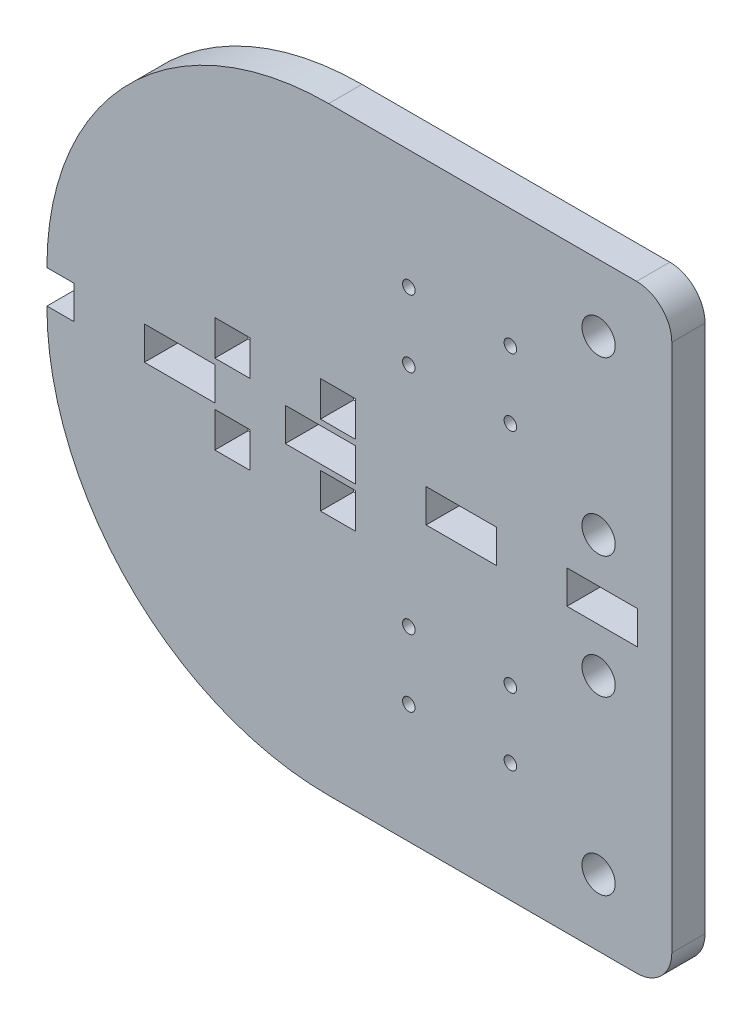
from build123d import *

# Parameters (mm, degrees)
SKETCH1_R           = 3
SKETCH1_R_2         = 1.13211215
SKETCH1_W           = 6.35
SKETCH1_H           = 6.35
SKETCH1_W_2         = 12.7
SKETCH1_H_2         = 5.9944
BOSS_EXTRUDE1_DEPTH = 5.9944


with BuildPart() as part:
    # Sketch1 → Boss-Extrude1 (new body)
    with BuildSketch(Plane(origin=(0, 0, 0), x_dir=(-1, 0, 0), z_dir=(0, 0, 1))):
        with BuildLine():
            Line((70.702589937, -4.554229729), (70.702589937, -4.32825998))
            Line((70.702589937, -4.32825998), (65.829579937, -4.32825998))
            Line((65.829579937, -4.32825998), (65.829579937, 1.66614002))
            Line((65.829579937, 1.66614002), (70.702589937, 1.66614002))
            Line((70.702589937, 1.66614002), (70.702589937, 1.892109768))
            ThreePointArc((70.702589937, 1.892109768), (55.823614421, 37.813134252), (19.902589937, 52.692109768))
            Line((19.902589937, 52.692109768), (-35.623445702, 52.692109768))
            ThreePointArc((-35.623445702, 52.692109768), (-40.113573763, 50.832237829), (-41.973445702, 46.342109768))
            Line((-41.973445702, 46.342109768), (-41.973445702, -49.004229729))
            ThreePointArc((-41.973445702, -49.004229729), (-40.113573763, -53.494357789), (-35.623445702, -55.354229729))
            Line((-35.623445702, -55.354229729), (19.902589937, -55.354229729))
            ThreePointArc((19.902589937, -55.354229729), (55.823614421, -40.475254213), (70.702589937, -4.554229729))
        make_face()
        with Locations((-28.770420063, -43.34064498)):
            Circle(SKETCH1_R, mode=Mode.SUBTRACT)
        with Locations((-12.862735063, -33.89562768)):
            Circle(SKETCH1_R_2, mode=Mode.SUBTRACT)
        with Locations((5.444904937, -33.89562768)):
            Circle(SKETCH1_R_2, mode=Mode.SUBTRACT)
        with Locations((-28.770420063, -12.34064498)):
            Circle(SKETCH1_R, mode=Mode.SUBTRACT)
        with Locations((-12.862735063, -21.78027768)):
            Circle(SKETCH1_R_2, mode=Mode.SUBTRACT)
        with Locations((5.444904937, -21.78027768)):
            Circle(SKETCH1_R_2, mode=Mode.SUBTRACT)
        with Locations((18.204579937, -8.50605998)):
            Rectangle(SKETCH1_W, SKETCH1_H, mode=Mode.SUBTRACT)
        with Locations((37.254579937, -8.50605998)):
            Rectangle(SKETCH1_W, SKETCH1_H, mode=Mode.SUBTRACT)
        with Locations((-29.420420063, -1.33105998)):
            Rectangle(SKETCH1_W_2, SKETCH1_H_2, mode=Mode.SUBTRACT)
        with Locations((-28.770420063, 9.67852502)):
            Circle(SKETCH1_R, mode=Mode.SUBTRACT)
        with Locations((-4.020420063, -1.33105998)):
            Rectangle(SKETCH1_W_2, SKETCH1_H_2, mode=Mode.SUBTRACT)
        with Locations((-12.862735063, 19.11815772)):
            Circle(SKETCH1_R_2, mode=Mode.SUBTRACT)
        with Locations((5.444904937, 19.11815772)):
            Circle(SKETCH1_R_2, mode=Mode.SUBTRACT)
        with Locations((-28.770420063, 40.67852502)):
            Circle(SKETCH1_R, mode=Mode.SUBTRACT)
        with Locations((-12.862735063, 31.23350772)):
            Circle(SKETCH1_R_2, mode=Mode.SUBTRACT)
        with Locations((5.444904937, 31.23350772)):
            Circle(SKETCH1_R_2, mode=Mode.SUBTRACT)
        with Locations((21.379579937, -1.33105998)):
            Rectangle(SKETCH1_W_2, SKETCH1_H_2, mode=Mode.SUBTRACT)
        with Locations((18.204579937, 5.84394002)):
            Rectangle(SKETCH1_W, SKETCH1_H, mode=Mode.SUBTRACT)
        with Locations((37.254579937, 5.84394002)):
            Rectangle(SKETCH1_W, SKETCH1_H, mode=Mode.SUBTRACT)
        with Locations((46.779579937, -1.33105998)):
            Rectangle(SKETCH1_W_2, SKETCH1_H_2, mode=Mode.SUBTRACT)
    extrude(amount=BOSS_EXTRUDE1_DEPTH)


solid = part.part
